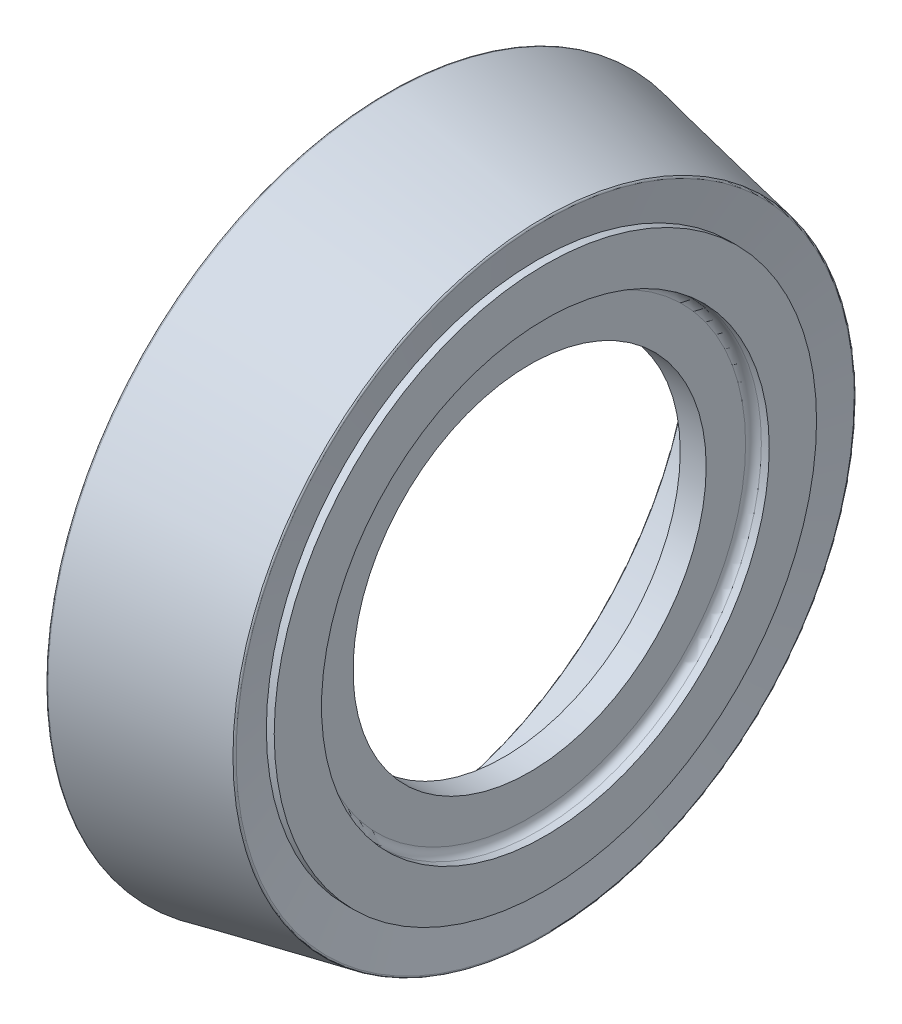
from build123d import *


with BuildPart() as part:
    # Szkic1 → Obrót1 (revolve)
    with BuildSketch(Plane.XY):
        with BuildLine():
            Line((0.5, 2.5), (1, 2.5))
            Line((1, 2.5), (1, 5.5))
            Line((1, 5.5), (0.5, 5.5))
            Line((0.5, 5.5), (0.980388386, 7.901941932))
            ThreePointArc((0.980388386, 7.901941932), (0.965535348, 7.977023566), (0.901941932, 8.019611614))
            Line((0.901941932, 8.019611614), (-8.880388386, 9.976077677))
            ThreePointArc((-8.880388386, 9.976077677), (-8.963398891, 9.955353824), (-9, 9.87801961))
            Line((-9, 9.87801961), (-9, 7.58198039))
            ThreePointArc((-9, 7.58198039), (-8.977334214, 7.5185815), (-8.919611614, 7.483922323))
            Line((-8.919611614, 7.483922323), (-1.645644932, 6.029128986))
            Line((-1.645644932, 6.029128986), (-1.645644932, -0.5))
            Line((-1.645644932, -0.5), (0, -0.5))
            Line((0, -0.5), (0, 2))
            ThreePointArc((0, 2), (0.146446609, 2.353553391), (0.5, 2.5))
        make_face()
    revolve(axis=Axis((0, -11.7, 0), (-1, 0, 0)))


solid = part.part
